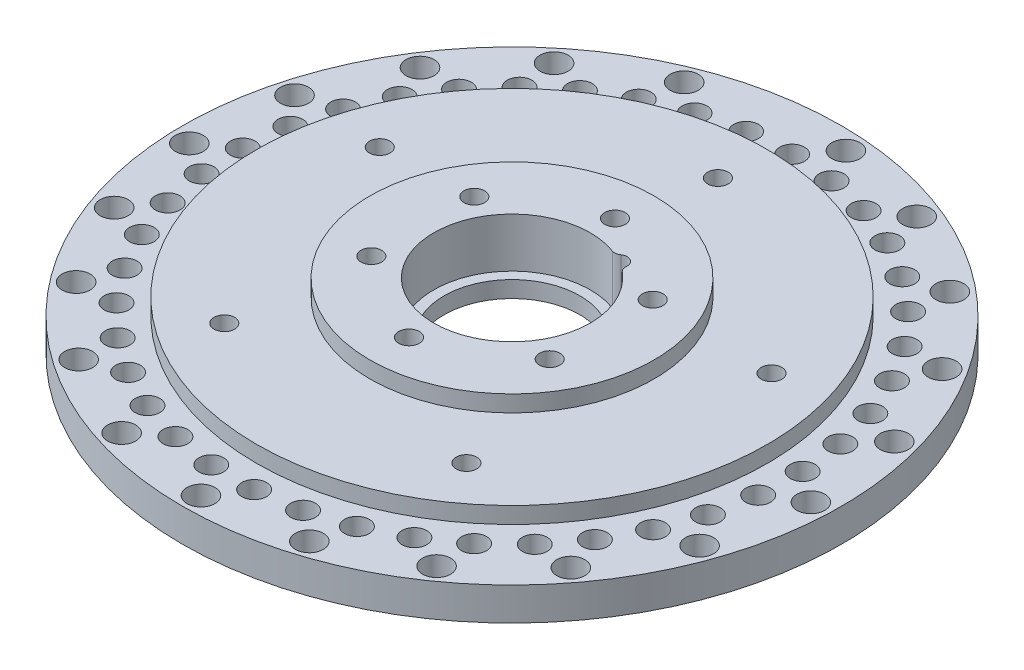
from build123d import *

# Parameters (mm, degrees)
SKETCH1_R                         = 40
PODSTAWA_DEPTH                    = 6
GNIAZDO_LOZYSKA_REACH             = 58.886
SKETCH2_R                         = 9.5
GNIAZDO_LOZYSKA_DIRECTION_2_DEPTH = 57.885850613
WALKI_CYKLOIDY_D                  = 3
M3_CLEARANCE_HOLE1_D              = 3.4
PROG_START                        = 2
SKETCH9_R                         = 9.5
SKETCH9_R_2                       = 8.25
PROG_LOZYSKA_DEPTH                = 2
TAP_DRILL_FOR_M3_TAP2_D           = 2.5
SKETCH12_R                        = 1
CUT_EXTRUDE1_DEPTH                = 4
FILLET1_R                         = 1
TAP_DRILL_FOR_M3_TAP3_D           = 2.5
TAP_DRILL_FOR_M3_TAP3_DEPTH       = 6
TAP_DRILL_FOR_M3_TAP3_TIP         = 0.751075774
SKETCH16_R                        = 17.25
SKETCH16_R_2                      = 1.25
BOSS_EXTRUDE1_DEPTH               = 2
CHAMFER1_SIZE                     = 0.5
CUT_EXTRUDE2_START                = -2
SKETCH17_R                        = 40
SKETCH17_R_2                      = 31
SKETCH17_R_3                      = 1.7
CUT_EXTRUDE2_DEPTH                = 2


# Read off the part's stored shape, not the designer's step: CirPattern8
with BuildPart() as part:
    # Sketch1 → podstawa (new body)
    with BuildSketch(Plane(origin=(0, 0, 0), x_dir=(1, 0, 0), z_dir=(0, 1, 0))):
        with Locations(Location((0, 0, 0), (0, 0, 270))):
            Circle(SKETCH1_R)
    extrude(amount=PODSTAWA_DEPTH)

    # Sketch2 → gniazdo lozyska (cut, up to next)
    with BuildSketch(Plane(origin=(0, 6, 0), x_dir=(1, 0, 0), z_dir=(0, 1, 0)), mode=Mode.PRIVATE) as gniazdo_lozyska_sk1:
        with Locations(Location((0, 0, 0), (0, 0, 90))):
            Circle(SKETCH2_R)
    gniazdo_lozyska_tool1 = extrude(gniazdo_lozyska_sk1.sketch, amount=-GNIAZDO_LOZYSKA_REACH, mode=Mode.PRIVATE) & part.part
    add(gniazdo_lozyska_tool1.solids().sort_by_distance((0, 6, 0))[0], mode=Mode.SUBTRACT)

    # Sketch2 → gniazdo lozyska direction 2 (cut)
    with BuildSketch(Plane(origin=(0, 6, 0), x_dir=(1, 0, 0), z_dir=(0, 1, 0))):
        with Locations(Location((0, 0, 0), (0, 0, 90))):
            Circle(SKETCH2_R)
    extrude(amount=GNIAZDO_LOZYSKA_DIRECTION_2_DEPTH, mode=Mode.SUBTRACT)

    # walki cykloidy (through all)
    with Locations(Plane(origin=(0, 6, 0), x_dir=(1, 0, 0), z_dir=(0, 1, 0))):
        with Locations((0, 34), (5.190075663, 33.601534409), (10.258500352, 32.41547733), (15.086474487, 30.469628937), (19.560834447, 27.809598266), (23.576705027, 24.497734182), (27.039957623, 20.611663973), (29.869416531, 16.242473829), (31.998761631, 11.492573866), (33.37808288, 6.473297712), (33.975050156, 1.302292945), (33.775671052, -3.899236464), (32.784618845, -9.009371075), (31.02512296, -13.908333664), (28.538424488, -18.4812967), (25.382809535, -22.621073806), (21.632243039, -26.230632114), (17.374635101, -29.225366638), (12.709780443, -31.535083337), (7.747019303, -33.105644412), (2.602674596, -33.90023724), (-2.602674596, -33.90023724), (-7.747019303, -33.105644412), (-12.709780443, -31.535083337), (-17.374635101, -29.225366638), (-21.632243039, -26.230632114), (-25.382809535, -22.621073806), (-28.538424488, -18.4812967), (-31.02512296, -13.908333664), (-32.784618845, -9.009371075), (-33.775671052, -3.899236464), (-33.975050156, 1.302292945), (-33.37808288, 6.473297712), (-31.998761631, 11.492573866), (-29.869416531, 16.242473829), (-27.039957623, 20.611663973), (-23.576705027, 24.497734182), (-19.560834447, 27.809598266), (-15.086474487, 30.469628937), (-10.258500352, 32.41547733), (-5.190075663, 33.601534409)):
            Hole(WALKI_CYKLOIDY_D / 2)

    # M3 Clearance Hole1 (through all)
    with Locations(Plane(origin=(0, 6, 0), x_dir=(1, 0, 0), z_dir=(0, 1, 0))):
        with Locations((-14.111594462, 35.013217529), (2.889734295, 37.639233995), (14.111594462, 35.013217529), (24.018152198, 29.123716538), (31.686044836, 20.519675013), (36.400569453, 10.003051708), (37.722298335, -1.445928197), (35.528036811, -12.76013716), (30.022305891, -22.885009264), (21.718279423, -30.876833369), (11.389952597, -35.9907138), (0, -37.75), (-11.389952597, -35.9907138), (-21.718279423, -30.876833369), (-30.022305891, -22.885009264), (-35.528036811, -12.76013716), (-37.722298335, -1.445928197), (-36.400569453, 10.003051708), (-31.686044836, 20.519675013), (-24.018152198, 29.123716538)):
            Hole(M3_CLEARANCE_HOLE1_D / 2)

    # Sketch9 → prog lozyska (add)
    with BuildSketch(Plane(origin=(0, 0, 0), x_dir=(1, 0, 0), z_dir=(0, 1, 0)).offset(PROG_START)):
        with Locations(Location((0, 0, 0), (0, 0, 90))):
            Circle(SKETCH9_R)
        with Locations(Location((0, 0, 0), (0, 0, 270))):
            Circle(SKETCH9_R_2, mode=Mode.SUBTRACT)
    extrude(amount=-PROG_LOZYSKA_DEPTH)

    # Tap Drill for M3 Tap2 (through all)
    with Locations(Plane(origin=(0, 6, 0), x_dir=(1, 0, 0), z_dir=(0, 1, 0))):
        with Locations((0, 12.5), (10.825317547, 6.25), (10.825317547, -6.25), (0, -12.5), (-10.825317547, -6.25), (-10.825317547, 6.25)):
            Hole(TAP_DRILL_FOR_M3_TAP2_D / 2)

    # Sketch12 → Cut-Extrude1 (cut)
    with BuildSketch(Plane(origin=(0, 6, 0), x_dir=(1, 0, 0), z_dir=(0, 1, 0))):
        with Locations((4.75, 8.227241336)):
            Circle(SKETCH12_R)
    extrude(amount=-CUT_EXTRUDE1_DEPTH, mode=Mode.SUBTRACT)

    # Fillet1
    fillet1_edges = [part.edges().sort_by_distance(p)[0] for p in [
        (5.588509301, 4, -7.682354053),
        (3.85885912, 4, -8.680968051),
    ]]
    fillet(fillet1_edges, radius=FILLET1_R)

    # Tap Drill for M3 Tap3
    with Locations(Plane(origin=(0, 6, 0), x_dir=(1, 0, 0), z_dir=(0, 1, 0))):
        with Locations((0, 25), (23.776412907, 7.725424859), (14.694631307, -20.225424859), (-14.694631307, -20.225424859), (-23.776412907, 7.725424859)):
            Hole(TAP_DRILL_FOR_M3_TAP3_D / 2, depth=TAP_DRILL_FOR_M3_TAP3_DEPTH)
            with Locations((0, 0, -(TAP_DRILL_FOR_M3_TAP3_DEPTH + TAP_DRILL_FOR_M3_TAP3_TIP / 2))):  # 118° drill point
                Cone(0, TAP_DRILL_FOR_M3_TAP3_D / 2, TAP_DRILL_FOR_M3_TAP3_TIP, mode=Mode.SUBTRACT)

    # Sketch16 → Boss-Extrude1 (add)
    with BuildSketch(Plane(origin=(0, 6, 0), x_dir=(1, 0, 0), z_dir=(0, 1, 0))):
        with Locations(Location((0, 0, 0), (0, 0, 270))):
            Circle(SKETCH16_R)
        with Locations(Location((10.825317547, 6.25, 0), (0, 0, 270))):
            Circle(SKETCH16_R_2, mode=Mode.SUBTRACT)
        with Locations(Location((10.825317547, -6.25, 0), (0, 0, 270))):
            Circle(SKETCH16_R_2, mode=Mode.SUBTRACT)
        with Locations(Location((0, -12.5, 0), (0, 0, 270))):
            Circle(SKETCH16_R_2, mode=Mode.SUBTRACT)
        with Locations(Location((-10.825317547, -6.25, 0), (0, 0, 270))):
            Circle(SKETCH16_R_2, mode=Mode.SUBTRACT)
        with Locations(Location((-10.825317547, 6.25, 0), (0, 0, 270))):
            Circle(SKETCH16_R_2, mode=Mode.SUBTRACT)
        with Locations(Location((0, 12.5, 0), (0, 0, 270))):
            Circle(SKETCH16_R_2, mode=Mode.SUBTRACT)
        with BuildLine():
            ThreePointArc((3.257160804, 8.924175228), (-4.75, -8.227241336), (6.099982053, 7.282871614))
            ThreePointArc((6.099982053, 7.282871614), (5.818046412, 7.667191499), (5.746042714, 8.138365508))
            ThreePointArc((5.746042714, 8.138365508), (5.25, 9.09326674), (4.175009918, 9.045401715))
            ThreePointArc((4.175009918, 9.045401715), (3.730959408, 8.872171743), (3.257160804, 8.924175228))
        make_face(mode=Mode.SUBTRACT)
    extrude(amount=BOSS_EXTRUDE1_DEPTH)

    # Chamfer1
    chamfer1_edges = [part.edges().sort_by_distance(p)[0] for p in [
        (-1.102674596, 0, 33.90023724),
        (4.102674596, 0, 33.90023724),
        (9.247019303, 0, 33.105644412),
    ]]
    chamfer(chamfer1_edges, length=CHAMFER1_SIZE)

    # CirPattern8 outline → CirPattern8 (revolve, cut)
    with BuildSketch(Plane.XY.offset(-34)):
        Polygon((2, 0), (1.5, 0.5), (1.5, 0), align=None)
    revolve(axis=Axis((0, 0, -34), (0, 1, 0)), mode=Mode.SUBTRACT)

    # CirPattern8 2 outline → CirPattern8 2 (revolve, cut)
    with BuildSketch(Plane(origin=(5.190075663, 0, -33.601534409), x_dir=(1, 0, 0), z_dir=(0, 0, 1))):
        Polygon((2, 0), (1.5, 0.5), (1.5, 0), align=None)
    revolve(axis=Axis((5.190075663, 0, -33.601534409), (0, 1, 0)), mode=Mode.SUBTRACT)

    # CirPattern8 3 outline → CirPattern8 3 (revolve, cut)
    with BuildSketch(Plane(origin=(10.258500352, 0, -32.41547733), x_dir=(1, 0, 0), z_dir=(0, 0, 1))):
        Polygon((2, 0), (1.5, 0.5), (1.5, 0), align=None)
    revolve(axis=Axis((10.258500352, 0, -32.41547733), (0, 1, 0)), mode=Mode.SUBTRACT)

    # CirPattern8 4 outline → CirPattern8 4 (revolve, cut)
    with BuildSketch(Plane(origin=(15.086474487, 0, -30.469628937), x_dir=(1, 0, 0), z_dir=(0, 0, 1))):
        Polygon((2, 0), (1.5, 0.5), (1.5, 0), align=None)
    revolve(axis=Axis((15.086474487, 0, -30.469628937), (0, 1, 0)), mode=Mode.SUBTRACT)

    # CirPattern8 5 outline → CirPattern8 5 (revolve, cut)
    with BuildSketch(Plane(origin=(19.560834447, 0, -27.809598266), x_dir=(1, 0, 0), z_dir=(0, 0, 1))):
        Polygon((2, 0), (1.5, 0.5), (1.5, 0), align=None)
    revolve(axis=Axis((19.560834447, 0, -27.809598266), (0, 1, 0)), mode=Mode.SUBTRACT)

    # CirPattern8 6 outline → CirPattern8 6 (revolve, cut)
    with BuildSketch(Plane(origin=(23.576705027, 0, -24.497734182), x_dir=(1, 0, 0), z_dir=(0, 0, 1))):
        Polygon((2, 0), (1.5, 0.5), (1.5, 0), align=None)
    revolve(axis=Axis((23.576705027, 0, -24.497734182), (0, 1, 0)), mode=Mode.SUBTRACT)

    # CirPattern8 7 outline → CirPattern8 7 (revolve, cut)
    with BuildSketch(Plane(origin=(27.039957623, 0, -20.611663973), x_dir=(1, 0, 0), z_dir=(0, 0, 1))):
        Polygon((2, 0), (1.5, 0.5), (1.5, 0), align=None)
    revolve(axis=Axis((27.039957623, 0, -20.611663973), (0, 1, 0)), mode=Mode.SUBTRACT)

    # CirPattern8 8 outline → CirPattern8 8 (revolve, cut)
    with BuildSketch(Plane(origin=(29.869416531, 0, -16.242473829), x_dir=(1, 0, 0), z_dir=(0, 0, 1))):
        Polygon((2, 0), (1.5, 0.5), (1.5, 0), align=None)
    revolve(axis=Axis((29.869416531, 0, -16.242473829), (0, 1, 0)), mode=Mode.SUBTRACT)

    # CirPattern8 9 outline → CirPattern8 9 (revolve, cut)
    with BuildSketch(Plane(origin=(31.998761631, 0, -11.492573866), x_dir=(1, 0, 0), z_dir=(0, 0, 1))):
        Polygon((2, 0), (1.5, 0.5), (1.5, 0), align=None)
    revolve(axis=Axis((31.998761631, 0, -11.492573866), (0, 1, 0)), mode=Mode.SUBTRACT)

    # CirPattern8 10 outline → CirPattern8 10 (revolve, cut)
    with BuildSketch(Plane(origin=(33.37808288, 0, -6.473297712), x_dir=(1, 0, 0), z_dir=(0, 0, 1))):
        Polygon((2, 0), (1.5, 0.5), (1.5, 0), align=None)
    revolve(axis=Axis((33.37808288, 0, -6.473297712), (0, 1, 0)), mode=Mode.SUBTRACT)

    # CirPattern8 11 outline → CirPattern8 11 (revolve, cut)
    with BuildSketch(Plane(origin=(33.975050156, 0, -1.302292945), x_dir=(1, 0, 0), z_dir=(0, 0, 1))):
        Polygon((2, 0), (1.5, 0.5), (1.5, 0), align=None)
    revolve(axis=Axis((33.975050156, 0, -1.302292945), (0, 1, 0)), mode=Mode.SUBTRACT)

    # CirPattern8 12 outline → CirPattern8 12 (revolve, cut)
    with BuildSketch(Plane(origin=(33.775671052, 0, 3.899236464), x_dir=(1, 0, 0), z_dir=(0, 0, 1))):
        Polygon((2, 0), (1.5, 0.5), (1.5, 0), align=None)
    revolve(axis=Axis((33.775671052, 0, 3.899236464), (0, 1, 0)), mode=Mode.SUBTRACT)

    # CirPattern8 13 outline → CirPattern8 13 (revolve, cut)
    with BuildSketch(Plane(origin=(32.784618845, 0, 9.009371075), x_dir=(1, 0, 0), z_dir=(0, 0, 1))):
        Polygon((2, 0), (1.5, 0.5), (1.5, 0), align=None)
    revolve(axis=Axis((32.784618845, 0, 9.009371075), (0, 1, 0)), mode=Mode.SUBTRACT)

    # CirPattern8 14 outline → CirPattern8 14 (revolve, cut)
    with BuildSketch(Plane(origin=(31.02512296, 0, 13.908333664), x_dir=(1, 0, 0), z_dir=(0, 0, 1))):
        Polygon((2, 0), (1.5, 0.5), (1.5, 0), align=None)
    revolve(axis=Axis((31.02512296, 0, 13.908333664), (0, 1, 0)), mode=Mode.SUBTRACT)

    # CirPattern8 15 outline → CirPattern8 15 (revolve, cut)
    with BuildSketch(Plane(origin=(28.538424488, 0, 18.4812967), x_dir=(1, 0, 0), z_dir=(0, 0, 1))):
        Polygon((2, 0), (1.5, 0.5), (1.5, 0), align=None)
    revolve(axis=Axis((28.538424488, 0, 18.4812967), (0, 1, 0)), mode=Mode.SUBTRACT)

    # CirPattern8 16 outline → CirPattern8 16 (revolve, cut)
    with BuildSketch(Plane(origin=(25.382809535, 0, 22.621073806), x_dir=(1, 0, 0), z_dir=(0, 0, 1))):
        Polygon((2, 0), (1.5, 0.5), (1.5, 0), align=None)
    revolve(axis=Axis((25.382809535, 0, 22.621073806), (0, 1, 0)), mode=Mode.SUBTRACT)

    # CirPattern8 17 outline → CirPattern8 17 (revolve, cut)
    with BuildSketch(Plane(origin=(21.632243039, 0, 26.230632114), x_dir=(1, 0, 0), z_dir=(0, 0, 1))):
        Polygon((2, 0), (1.5, 0.5), (1.5, 0), align=None)
    revolve(axis=Axis((21.632243039, 0, 26.230632114), (0, 1, 0)), mode=Mode.SUBTRACT)

    # CirPattern8 18 outline → CirPattern8 18 (revolve, cut)
    with BuildSketch(Plane(origin=(17.374635101, 0, 29.225366638), x_dir=(1, 0, 0), z_dir=(0, 0, 1))):
        Polygon((2, 0), (1.5, 0.5), (1.5, 0), align=None)
    revolve(axis=Axis((17.374635101, 0, 29.225366638), (0, 1, 0)), mode=Mode.SUBTRACT)

    # CirPattern8 19 outline → CirPattern8 19 (revolve, cut)
    with BuildSketch(Plane(origin=(12.709780443, 0, 31.535083337), x_dir=(1, 0, 0), z_dir=(0, 0, 1))):
        Polygon((2, 0), (1.5, 0.5), (1.5, 0), align=None)
    revolve(axis=Axis((12.709780443, 0, 31.535083337), (0, 1, 0)), mode=Mode.SUBTRACT)

    # CirPattern8 20 outline → CirPattern8 20 (revolve, cut)
    with BuildSketch(Plane(origin=(-7.747019303, 0, 33.105644412), x_dir=(1, 0, 0), z_dir=(0, 0, 1))):
        Polygon((2, 0), (1.5, 0.5), (1.5, 0), align=None)
    revolve(axis=Axis((-7.747019303, 0, 33.105644412), (0, 1, 0)), mode=Mode.SUBTRACT)

    # CirPattern8 21 outline → CirPattern8 21 (revolve, cut)
    with BuildSketch(Plane(origin=(-12.709780443, 0, 31.535083337), x_dir=(1, 0, 0), z_dir=(0, 0, 1))):
        Polygon((2, 0), (1.5, 0.5), (1.5, 0), align=None)
    revolve(axis=Axis((-12.709780443, 0, 31.535083337), (0, 1, 0)), mode=Mode.SUBTRACT)

    # CirPattern8 22 outline → CirPattern8 22 (revolve, cut)
    with BuildSketch(Plane(origin=(-17.374635101, 0, 29.225366638), x_dir=(1, 0, 0), z_dir=(0, 0, 1))):
        Polygon((2, 0), (1.5, 0.5), (1.5, 0), align=None)
    revolve(axis=Axis((-17.374635101, 0, 29.225366638), (0, 1, 0)), mode=Mode.SUBTRACT)

    # CirPattern8 23 outline → CirPattern8 23 (revolve, cut)
    with BuildSketch(Plane(origin=(-21.632243039, 0, 26.230632114), x_dir=(1, 0, 0), z_dir=(0, 0, 1))):
        Polygon((2, 0), (1.5, 0.5), (1.5, 0), align=None)
    revolve(axis=Axis((-21.632243039, 0, 26.230632114), (0, 1, 0)), mode=Mode.SUBTRACT)

    # CirPattern8 24 outline → CirPattern8 24 (revolve, cut)
    with BuildSketch(Plane(origin=(-25.382809535, 0, 22.621073806), x_dir=(1, 0, 0), z_dir=(0, 0, 1))):
        Polygon((2, 0), (1.5, 0.5), (1.5, 0), align=None)
    revolve(axis=Axis((-25.382809535, 0, 22.621073806), (0, 1, 0)), mode=Mode.SUBTRACT)

    # CirPattern8 25 outline → CirPattern8 25 (revolve, cut)
    with BuildSketch(Plane(origin=(-28.538424488, 0, 18.4812967), x_dir=(1, 0, 0), z_dir=(0, 0, 1))):
        Polygon((2, 0), (1.5, 0.5), (1.5, 0), align=None)
    revolve(axis=Axis((-28.538424488, 0, 18.4812967), (0, 1, 0)), mode=Mode.SUBTRACT)

    # CirPattern8 26 outline → CirPattern8 26 (revolve, cut)
    with BuildSketch(Plane(origin=(-31.02512296, 0, 13.908333664), x_dir=(1, 0, 0), z_dir=(0, 0, 1))):
        Polygon((2, 0), (1.5, 0.5), (1.5, 0), align=None)
    revolve(axis=Axis((-31.02512296, 0, 13.908333664), (0, 1, 0)), mode=Mode.SUBTRACT)

    # CirPattern8 27 outline → CirPattern8 27 (revolve, cut)
    with BuildSketch(Plane(origin=(-32.784618845, 0, 9.009371075), x_dir=(1, 0, 0), z_dir=(0, 0, 1))):
        Polygon((2, 0), (1.5, 0.5), (1.5, 0), align=None)
    revolve(axis=Axis((-32.784618845, 0, 9.009371075), (0, 1, 0)), mode=Mode.SUBTRACT)

    # CirPattern8 28 outline → CirPattern8 28 (revolve, cut)
    with BuildSketch(Plane(origin=(-33.775671052, 0, 3.899236464), x_dir=(1, 0, 0), z_dir=(0, 0, 1))):
        Polygon((2, 0), (1.5, 0.5), (1.5, 0), align=None)
    revolve(axis=Axis((-33.775671052, 0, 3.899236464), (0, 1, 0)), mode=Mode.SUBTRACT)

    # CirPattern8 29 outline → CirPattern8 29 (revolve, cut)
    with BuildSketch(Plane(origin=(-33.975050156, 0, -1.302292945), x_dir=(1, 0, 0), z_dir=(0, 0, 1))):
        Polygon((2, 0), (1.5, 0.5), (1.5, 0), align=None)
    revolve(axis=Axis((-33.975050156, 0, -1.302292945), (0, 1, 0)), mode=Mode.SUBTRACT)

    # CirPattern8 30 outline → CirPattern8 30 (revolve, cut)
    with BuildSketch(Plane(origin=(-33.37808288, 0, -6.473297712), x_dir=(1, 0, 0), z_dir=(0, 0, 1))):
        Polygon((2, 0), (1.5, 0.5), (1.5, 0), align=None)
    revolve(axis=Axis((-33.37808288, 0, -6.473297712), (0, 1, 0)), mode=Mode.SUBTRACT)

    # CirPattern8 31 outline → CirPattern8 31 (revolve, cut)
    with BuildSketch(Plane(origin=(-31.998761631, 0, -11.492573866), x_dir=(1, 0, 0), z_dir=(0, 0, 1))):
        Polygon((2, 0), (1.5, 0.5), (1.5, 0), align=None)
    revolve(axis=Axis((-31.998761631, 0, -11.492573866), (0, 1, 0)), mode=Mode.SUBTRACT)

    # CirPattern8 32 outline → CirPattern8 32 (revolve, cut)
    with BuildSketch(Plane(origin=(-29.869416531, 0, -16.242473829), x_dir=(1, 0, 0), z_dir=(0, 0, 1))):
        Polygon((2, 0), (1.5, 0.5), (1.5, 0), align=None)
    revolve(axis=Axis((-29.869416531, 0, -16.242473829), (0, 1, 0)), mode=Mode.SUBTRACT)

    # CirPattern8 33 outline → CirPattern8 33 (revolve, cut)
    with BuildSketch(Plane(origin=(-27.039957623, 0, -20.611663973), x_dir=(1, 0, 0), z_dir=(0, 0, 1))):
        Polygon((2, 0), (1.5, 0.5), (1.5, 0), align=None)
    revolve(axis=Axis((-27.039957623, 0, -20.611663973), (0, 1, 0)), mode=Mode.SUBTRACT)

    # CirPattern8 34 outline → CirPattern8 34 (revolve, cut)
    with BuildSketch(Plane(origin=(-23.576705027, 0, -24.497734182), x_dir=(1, 0, 0), z_dir=(0, 0, 1))):
        Polygon((2, 0), (1.5, 0.5), (1.5, 0), align=None)
    revolve(axis=Axis((-23.576705027, 0, -24.497734182), (0, 1, 0)), mode=Mode.SUBTRACT)

    # CirPattern8 35 outline → CirPattern8 35 (revolve, cut)
    with BuildSketch(Plane(origin=(-19.560834447, 0, -27.809598266), x_dir=(1, 0, 0), z_dir=(0, 0, 1))):
        Polygon((2, 0), (1.5, 0.5), (1.5, 0), align=None)
    revolve(axis=Axis((-19.560834447, 0, -27.809598266), (0, 1, 0)), mode=Mode.SUBTRACT)

    # CirPattern8 36 outline → CirPattern8 36 (revolve, cut)
    with BuildSketch(Plane(origin=(-15.086474487, 0, -30.469628937), x_dir=(1, 0, 0), z_dir=(0, 0, 1))):
        Polygon((2, 0), (1.5, 0.5), (1.5, 0), align=None)
    revolve(axis=Axis((-15.086474487, 0, -30.469628937), (0, 1, 0)), mode=Mode.SUBTRACT)

    # CirPattern8 37 outline → CirPattern8 37 (revolve, cut)
    with BuildSketch(Plane(origin=(-10.258500352, 0, -32.41547733), x_dir=(1, 0, 0), z_dir=(0, 0, 1))):
        Polygon((2, 0), (1.5, 0.5), (1.5, 0), align=None)
    revolve(axis=Axis((-10.258500352, 0, -32.41547733), (0, 1, 0)), mode=Mode.SUBTRACT)

    # CirPattern8 38 outline → CirPattern8 38 (revolve, cut)
    with BuildSketch(Plane(origin=(-5.190075663, 0, -33.601534409), x_dir=(1, 0, 0), z_dir=(0, 0, 1))):
        Polygon((2, 0), (1.5, 0.5), (1.5, 0), align=None)
    revolve(axis=Axis((-5.190075663, 0, -33.601534409), (0, 1, 0)), mode=Mode.SUBTRACT)

    # Sketch17 → Cut-Extrude2 (cut)
    # profile 1 of 11: a face of its own
    with BuildSketch(Plane(origin=(0, 6, 0), x_dir=(1, 0, 0), z_dir=(0, 1, 0)).offset(CUT_EXTRUDE2_START)):
        with Locations(Location((0, 0, 0), (0, 0, 270))):
            Circle(SKETCH17_R)
        with Locations(Location((0, 0, 0), (0, 0, 270))):
            Circle(SKETCH17_R_2, mode=Mode.SUBTRACT)
        with Locations(Location((2.889734295, 37.639233995, 0), (0, 0, 270))):
            Circle(SKETCH17_R_3, mode=Mode.SUBTRACT)
        with Locations(Location((-31.686044836, 20.519675013, 0), (0, 0, 270))):
            Circle(SKETCH17_R_3, mode=Mode.SUBTRACT)
        with Locations(Location((-37.722298335, -1.445928197, 0), (0, 0, 270))):
            Circle(SKETCH17_R_3, mode=Mode.SUBTRACT)
        with Locations(Location((-30.022305891, -22.885009264, 0), (0, 0, 270))):
            Circle(SKETCH17_R_3, mode=Mode.SUBTRACT)
        with Locations(Location((-21.718279423, -30.876833369, 0), (0, 0, 270))):
            Circle(SKETCH17_R_3, mode=Mode.SUBTRACT)
        with Locations(Location((0, -37.75, 0), (0, 0, 270))):
            Circle(SKETCH17_R_3, mode=Mode.SUBTRACT)
        with Locations(Location((21.718279423, -30.876833369, 0), (0, 0, 270))):
            Circle(SKETCH17_R_3, mode=Mode.SUBTRACT)
        with Locations(Location((30.022305891, -22.885009264, 0), (0, 0, 270))):
            Circle(SKETCH17_R_3, mode=Mode.SUBTRACT)
        with Locations(Location((37.722298335, -1.445928197, 0), (0, 0, 270))):
            Circle(SKETCH17_R_3, mode=Mode.SUBTRACT)
        with Locations(Location((31.686044836, 20.519675013, 0), (0, 0, 270))):
            Circle(SKETCH17_R_3, mode=Mode.SUBTRACT)
    # profile 2 of 11: a face of its own
    with BuildSketch(Plane(origin=(0, 6, 0), x_dir=(1, 0, 0), z_dir=(0, 1, 0)).offset(CUT_EXTRUDE2_START)):
        with Locations(Location((-14.111594462, 35.013217529, 0), (0, 0, 270))):
            Circle(SKETCH17_R_3)
    # profile 3 of 11: a face of its own
    with BuildSketch(Plane(origin=(0, 6, 0), x_dir=(1, 0, 0), z_dir=(0, 1, 0)).offset(CUT_EXTRUDE2_START)):
        with Locations(Location((-24.018152198, 29.123716538, 0), (0, 0, 270))):
            Circle(SKETCH17_R_3)
    # profile 4 of 11: a face of its own
    with BuildSketch(Plane(origin=(0, 6, 0), x_dir=(1, 0, 0), z_dir=(0, 1, 0)).offset(CUT_EXTRUDE2_START)):
        with Locations(Location((-36.400569453, 10.003051708, 0), (0, 0, 270))):
            Circle(SKETCH17_R_3)
    # profile 5 of 11: a face of its own
    with BuildSketch(Plane(origin=(0, 6, 0), x_dir=(1, 0, 0), z_dir=(0, 1, 0)).offset(CUT_EXTRUDE2_START)):
        with Locations(Location((-35.528036811, -12.76013716, 0), (0, 0, 270))):
            Circle(SKETCH17_R_3)
    # profile 6 of 11: a face of its own
    with BuildSketch(Plane(origin=(0, 6, 0), x_dir=(1, 0, 0), z_dir=(0, 1, 0)).offset(CUT_EXTRUDE2_START)):
        with Locations(Location((-11.389952597, -35.9907138, 0), (0, 0, 270))):
            Circle(SKETCH17_R_3)
    # profile 7 of 11: a face of its own
    with BuildSketch(Plane(origin=(0, 6, 0), x_dir=(1, 0, 0), z_dir=(0, 1, 0)).offset(CUT_EXTRUDE2_START)):
        with Locations(Location((11.389952597, -35.9907138, 0), (0, 0, 270))):
            Circle(SKETCH17_R_3)
    # profile 8 of 11: a face of its own
    with BuildSketch(Plane(origin=(0, 6, 0), x_dir=(1, 0, 0), z_dir=(0, 1, 0)).offset(CUT_EXTRUDE2_START)):
        with Locations(Location((35.528036811, -12.76013716, 0), (0, 0, 270))):
            Circle(SKETCH17_R_3)
    # profile 9 of 11: a face of its own
    with BuildSketch(Plane(origin=(0, 6, 0), x_dir=(1, 0, 0), z_dir=(0, 1, 0)).offset(CUT_EXTRUDE2_START)):
        with Locations(Location((36.400569453, 10.003051708, 0), (0, 0, 270))):
            Circle(SKETCH17_R_3)
    # profile 10 of 11: a face of its own
    with BuildSketch(Plane(origin=(0, 6, 0), x_dir=(1, 0, 0), z_dir=(0, 1, 0)).offset(CUT_EXTRUDE2_START)):
        with Locations(Location((24.018152198, 29.123716538, 0), (0, 0, 270))):
            Circle(SKETCH17_R_3)
    # profile 11 of 11: a face of its own
    with BuildSketch(Plane(origin=(0, 6, 0), x_dir=(1, 0, 0), z_dir=(0, 1, 0)).offset(CUT_EXTRUDE2_START)):
        with Locations(Location((14.111594462, 35.013217529, 0), (0, 0, 270))):
            Circle(SKETCH17_R_3)
    extrude(amount=CUT_EXTRUDE2_DEPTH, mode=Mode.SUBTRACT)


solid = part.part
